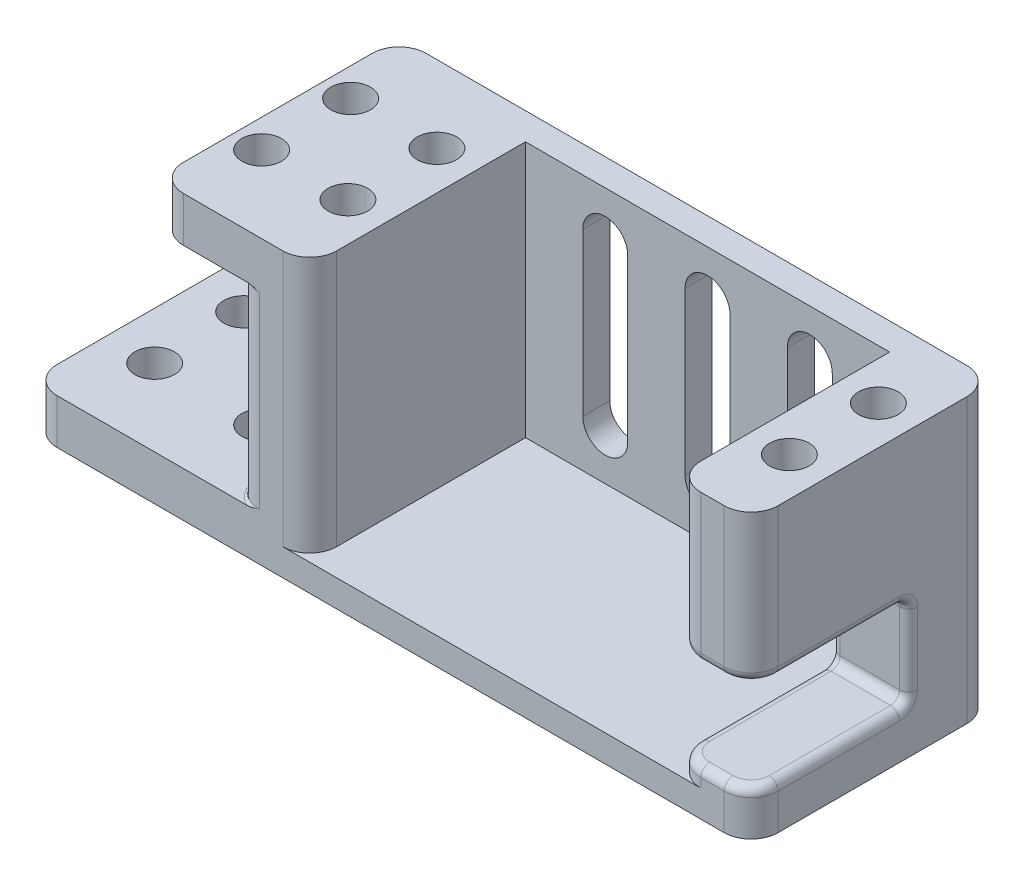
from build123d import *

# Parameters (mm, degrees)
SKETCH1_W           = 8.6
SKETCH1_H           = 27
BOSS_EXTRUDE1_DEPTH = 31.5
SKETCH2_W           = 27
SKETCH2_H           = 3
BOSS_EXTRUDE2_DEPTH = 40.5
SKETCH3_W           = 3
SKETCH3_H           = 28.5
BOSS_EXTRUDE3_DEPTH = 40.5
SKETCH4_W           = 8.6
SKETCH4_H           = 27
BOSS_EXTRUDE4_DEPTH = 31.5
CUT_EXTRUDE8_DEPTH  = 10
FILLET1_R           = 3
SKETCH5_R           = 2.2
CUT_EXTRUDE1_DEPTH  = 5
SKETCH6_W           = 17.5
SKETCH6_H           = 10
CUT_EXTRUDE2_DEPTH  = 10
FILLET3_R           = 1
SKETCH9_W           = 27
SKETCH9_H           = 5
BOSS_EXTRUDE5_DEPTH = 22.5
SKETCH10_R          = 2.2
CUT_EXTRUDE5_DEPTH  = 100
FILLET4_R           = 3
FILLET5_R           = 0.3
SKETCH12_W          = 14.05
SKETCH12_H          = 27
CUT_EXTRUDE6_DEPTH  = 10
FILLET6_R           = 3


with BuildPart() as part:
    # Sketch1 → Boss-Extrude1 (new body)
    with BuildSketch(Plane(origin=(0, 0, 0), x_dir=(1, 0, 0), z_dir=(0, 1, 0))):
        with Locations((4.3, 0)):
            Rectangle(SKETCH1_W, SKETCH1_H)
    extrude(amount=BOSS_EXTRUDE1_DEPTH)

    # Sketch2 → Boss-Extrude2 (add)
    with BuildSketch(Plane(origin=(8.6, 0, 0), x_dir=(0, 0, -1), z_dir=(1, 0, 0))):
        with Locations((0, 1.5)):
            Rectangle(SKETCH2_W, SKETCH2_H)
    extrude(amount=BOSS_EXTRUDE2_DEPTH)

    # Sketch3 → Boss-Extrude3 (add)
    with BuildSketch(Plane(origin=(8.6, 0, 0), x_dir=(0, 0, -1), z_dir=(1, 0, 0))):
        with Locations((12, 17.25)):
            Rectangle(SKETCH3_W, SKETCH3_H)
    extrude(amount=BOSS_EXTRUDE3_DEPTH)

    # Sketch4 → Boss-Extrude4 (add)
    with BuildSketch(Plane(origin=(0, 31.5, 0), x_dir=(1, 0, 0), z_dir=(0, 1, 0))):
        with Locations((53.4, 0)):
            Rectangle(SKETCH4_W, SKETCH4_H)
    extrude(amount=-BOSS_EXTRUDE4_DEPTH)

    # Sketch15 → Cut-Extrude8 (cut)
    with BuildSketch(Plane.XY.offset(-10.5)):
        with BuildLine():
            Line((31.35, 8.25), (31.35, 26.25))
            ThreePointArc((31.35, 26.25), (28.85, 28.75), (26.35, 26.25))
            Line((26.35, 26.25), (26.35, 8.25))
            ThreePointArc((26.35, 8.25), (28.85, 5.75), (31.35, 8.25))
        make_face()
        with BuildLine():
            Line((42.725, 8.25), (42.725, 26.25))
            ThreePointArc((42.725, 26.25), (40.225, 28.75), (37.725, 26.25))
            Line((37.725, 26.25), (37.725, 8.25))
            ThreePointArc((37.725, 8.25), (40.225, 5.75), (42.725, 8.25))
        make_face()
        with BuildLine():
            Line((19.975, 8.25), (19.975, 26.25))
            ThreePointArc((19.975, 26.25), (17.475, 28.75), (14.975, 26.25))
            Line((14.975, 26.25), (14.975, 8.25))
            ThreePointArc((14.975, 8.25), (17.475, 5.75), (19.975, 8.25))
        make_face()
    extrude(amount=-CUT_EXTRUDE8_DEPTH, mode=Mode.SUBTRACT)

    # Fillet1
    fillet1_edges = [part.edges().sort_by_distance(p)[0] for p in [
        (57.7, 15.75, -13.5),
        (57.7, 15.75, 13.5),
        (49.1, 17.25, 13.5),
        (8.6, 17.25, 13.5),
    ]]
    fillet(fillet1_edges, radius=FILLET1_R)

    # Sketch5 → Cut-Extrude1 (cut)
    with BuildSketch(Plane(origin=(0, 31.5, 0), x_dir=(1, 0, 0), z_dir=(0, 1, 0))):
        with Locations(Location((53.4, 4.95, 0), (0, 0, 270))):
            Circle(SKETCH5_R)
        with Locations(Location((53.4, -4.95, 0), (0, 0, 270))):
            Circle(SKETCH5_R)
        with Locations(Location((4.3, 4.95, 0), (0, 0, 270))):
            Circle(SKETCH5_R)
        with Locations(Location((4.3, -4.95, 0), (0, 0, 270))):
            Circle(SKETCH5_R)
    extrude(amount=-CUT_EXTRUDE1_DEPTH, mode=Mode.SUBTRACT)

    # Sketch6 → Cut-Extrude2 (cut)
    with BuildSketch(Plane.ZY.offset(-49.1)):
        with Locations((4.75, 10)):
            Rectangle(SKETCH6_W, SKETCH6_H)
    extrude(amount=-CUT_EXTRUDE2_DEPTH, mode=Mode.SUBTRACT)

    # Fillet3
    fillet3_edges = [part.edges().sort_by_distance(p)[0] for p in [
        (56.821320344, 5, 12.621320344),
        (56.821320344, 15, 12.621320344),
        (57.7, 10, -4),
        (49.1, 5, 3.25),
        (49.1, 15, 3.25),
        (49.1, 10, -4),
        (49.978679656, 15, 12.621320344),
        (57.7, 15, 3.25),
        (53.4, 15, 13.5),
        (49.978679656, 5, 12.621320344),
        (57.7, 5, 3.25),
        (53.4, 15, -4),
        (53.4, 5, 13.5),
        (53.4, 5, -4),
    ]]
    fillet(fillet3_edges, radius=FILLET3_R)

    # Sketch9 → Boss-Extrude5 (add)
    with BuildSketch(Plane.ZY):
        with Locations((0, 29)):
            Rectangle(SKETCH9_W, SKETCH9_H)
        with Locations((0, 2.5)):
            Rectangle(SKETCH9_W, SKETCH9_H)
    extrude(amount=BOSS_EXTRUDE5_DEPTH)

    # Sketch10 → Cut-Extrude5 (cut)
    with BuildSketch(Plane(origin=(0, 31.5, 0), x_dir=(1, 0, 0), z_dir=(0, 1, 0))):
        with Locations(Location((-5.3, 4.95, 0), (0, 0, 90))):
            Circle(SKETCH10_R)
        with Locations(Location((-5.3, -4.95, 0), (0, 0, 90))):
            Circle(SKETCH10_R)
        with Locations(Location((-17.2, -4.95, 0), (0, 0, 90))):
            Circle(SKETCH10_R)
        with Locations(Location((-17.2, 4.95, 0), (0, 0, 90))):
            Circle(SKETCH10_R)
    extrude(amount=-CUT_EXTRUDE5_DEPTH, mode=Mode.SUBTRACT)

    # Fillet4
    fillet4_edges = [part.edges().sort_by_distance(p)[0] for p in [
        (0, 15.75, 13.5),
        (0, 15.75, -13.5),
        (-22.5, 2.5, 13.5),
        (-22.5, 2.5, -13.5),
    ]]
    fillet(fillet4_edges, radius=FILLET4_R)

    # Fillet5
    # the kernel refuses this fillet: 0.3 mm, written as the material it adds along each edge
    with BuildSketch(Plane(origin=(0, 5, 10.5), x_dir=(0, 1, 0), z_dir=(0, 0, -1))) as fillet5_piece_1:
        with BuildLine():
            CenterArc((FILLET5_R, -FILLET5_R), FILLET5_R, 90, 90)
            Line((0, -FILLET5_R), (0, 0))
            Line((0, 0), (FILLET5_R, 0))
        make_face()
    extrude(amount=21)
    with BuildSketch(Plane(origin=(0, 26.5, 10.5), x_dir=(0, -1, 0), z_dir=(0, 0, -1))) as fillet5_piece_2:
        with BuildLine():
            CenterArc((FILLET5_R, FILLET5_R), FILLET5_R, 180, 90)
            Line((0, FILLET5_R), (0, 0))
            Line((0, 0), (FILLET5_R, 0))
        make_face()
    extrude(amount=21)
    with BuildSketch(Plane(origin=(3, 5, -10.5), x_dir=(-1, 0, 0), z_dir=(0, 0, 1))) as fillet5_piece_3_section:
        with BuildLine():
            CenterArc((3 + FILLET5_R, -FILLET5_R), FILLET5_R, 90, 90)
            Line((3 + FILLET5_R, 0), (3, 0))
            Line((3, 0), (3, -FILLET5_R))
        make_face()
    fillet5_piece_3 = revolve(axis=Axis((3, 5, -10.5), (0, -1, 0)), revolution_arc=104.329698924, mode=Mode.PRIVATE)
    fillet5_piece_3 = split(fillet5_piece_3, bisect_by=Plane(origin=(0.81861369, 5.084946104, -13.5), z_dir=(0, 0, 1)), keep=Keep.TOP, mode=Mode.PRIVATE)
    add(fillet5_piece_3)
    with BuildSketch(Plane(origin=(3, 26.5, -10.5), x_dir=(-1, 0, 0), z_dir=(0, 0, 1))) as fillet5_piece_4_section:
        with BuildLine():
            CenterArc((3 + FILLET5_R, FILLET5_R), FILLET5_R, 180, 90)
            Line((3 + FILLET5_R, 0), (3, 0))
            Line((3, 0), (3, FILLET5_R))
        make_face()
    fillet5_piece_4 = revolve(axis=Axis((3, 26.5, -10.5), (0, -1, 0)), revolution_arc=104.329698924, mode=Mode.PRIVATE)
    fillet5_piece_4 = split(fillet5_piece_4, bisect_by=Plane(origin=(0.81861369, 26.415053896, -13.5), z_dir=(0, 0, 1)), keep=Keep.TOP, mode=Mode.PRIVATE)
    add(fillet5_piece_4)
    with BuildSketch(Plane(origin=(3, 5, 10.5), x_dir=(0.24750126301206385, 0, 0.968887570777659), z_dir=(0.968887570777659, 0, -0.24750126301206385))) as fillet5_piece_5_section:
        with BuildLine():
            CenterArc((3 + FILLET5_R, -FILLET5_R), FILLET5_R, 90, 90)
            Line((3 + FILLET5_R, 0), (3, 0))
            Line((3, 0), (3, -FILLET5_R))
        make_face()
    fillet5_piece_5 = revolve(axis=Axis((3, 5, 10.5), (0, -1, 0)), revolution_arc=104.329698924, mode=Mode.PRIVATE)
    fillet5_piece_5 = split(fillet5_piece_5, bisect_by=Plane(origin=(0.818613701, 5.084946089, 13.5), z_dir=(0, 0, -1)), keep=Keep.TOP, mode=Mode.PRIVATE)
    add(fillet5_piece_5)
    with BuildSketch(Plane(origin=(3, 26.5, 10.5), x_dir=(0.24750126301206454, 0, 0.9688875707776589), z_dir=(0.9688875707776589, 0, -0.24750126301206454))) as fillet5_piece_6_section:
        with BuildLine():
            CenterArc((3 + FILLET5_R, FILLET5_R), FILLET5_R, 180, 90)
            Line((3, FILLET5_R), (3, 0))
            Line((3, 0), (3 + FILLET5_R, 0))
        make_face()
    fillet5_piece_6 = revolve(axis=Axis((3, 26.5, 10.5), (0, -1, 0)), revolution_arc=104.329698924, mode=Mode.PRIVATE)
    fillet5_piece_6 = split(fillet5_piece_6, bisect_by=Plane(origin=(0.818613746, 26.41505391, 13.5), z_dir=(0, 0, -1)), keep=Keep.TOP, mode=Mode.PRIVATE)
    add(fillet5_piece_6)

    # Sketch12 → Cut-Extrude6 (cut)
    with BuildSketch(Plane(origin=(0, 31.5, 0), x_dir=(1, 0, 0), z_dir=(0, 1, 0))):
        with Locations((-15.475, 0)):
            Rectangle(SKETCH12_W, SKETCH12_H)
    extrude(amount=-CUT_EXTRUDE6_DEPTH, mode=Mode.SUBTRACT)

    # Fillet6
    fillet6_edges = [part.edges().sort_by_distance(p)[0] for p in [
        (-8.45, 29, -13.5),
        (-8.45, 29, 13.5),
    ]]
    fillet(fillet6_edges, radius=FILLET6_R)


solid = part.part
